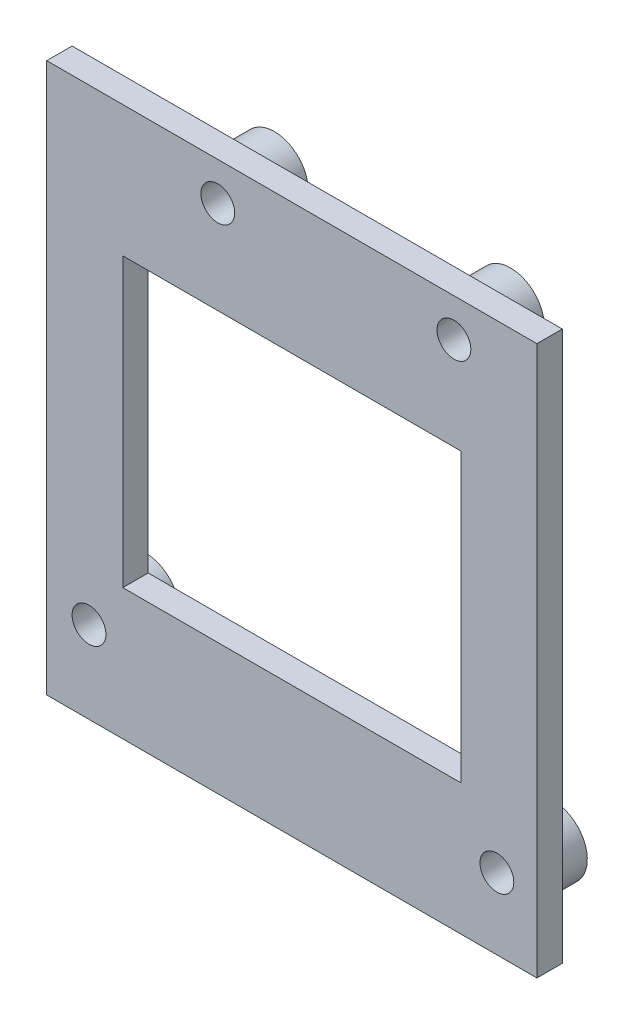
from build123d import *

# Parameters (mm, degrees)
ESQUISSE1_W               = 58
ESQUISSE1_H               = 65
T_LE_DE_BASE_PLI_E1_DEPTH = 3
ENL_V_MAT_EXTRU_1_REACH   = 45.661
ESQUISSE6_R               = 2
ENL_V_MAT_EXTRU_2_REACH   = 45.661
ESQUISSE7_R               = 2
ESQUISSE8_R               = 4
ESQUISSE8_R_2             = 2
BOSS_EXTRU_1_DEPTH        = 2.7
ESQUISSE11_R              = 4
BOSS_EXTRU_3_DEPTH        = 1
ENL_V_MAT_EXTRU_3_REACH   = 46.07
ESQUISSE9_W               = 40
ESQUISSE9_H               = 34
ESQUISSE12_R              = 4
ESQUISSE12_R_2            = 2
BOSS_EXTRU_4_DEPTH        = 3.7
ESQUISSE13_R              = 2
BOSS_EXTRU_5_DEPTH        = 1


# Sheet-metal steps are written as plain solids
with BuildPart() as part:
    # Esquisse1 → Tôle de base pliée1 (new body)
    with BuildSketch(Plane.XY):
        Rectangle(ESQUISSE1_W, ESQUISSE1_H)
    extrude(amount=-T_LE_DE_BASE_PLI_E1_DEPTH)

    # Esquisse6 → Enlèv. mat.-Extru.1 (cut, up to next)
    with BuildSketch(Plane.XY, mode=Mode.PRIVATE) as enl_v_mat_extru_1_sk1:
        with Locations((-8.76, 28)):
            Circle(ESQUISSE6_R)
    enl_v_mat_extru_1_tool1 = extrude(enl_v_mat_extru_1_sk1.sketch, amount=-ENL_V_MAT_EXTRU_1_REACH, mode=Mode.PRIVATE) & part.part
    # Esquisse6 → Enlèv. mat.-Extru.1 (cut, up to next)
    with BuildSketch(Plane.XY, mode=Mode.PRIVATE) as enl_v_mat_extru_1_sk2:
        with Locations((19.18, 28)):
            Circle(ESQUISSE6_R)
    enl_v_mat_extru_1_tool2 = extrude(enl_v_mat_extru_1_sk2.sketch, amount=-ENL_V_MAT_EXTRU_1_REACH, mode=Mode.PRIVATE) & part.part
    # Esquisse6 → Enlèv. mat.-Extru.1 (cut, up to next)
    with BuildSketch(Plane.XY, mode=Mode.PRIVATE) as enl_v_mat_extru_1_sk3:
        with Locations((-24, -22.8)):
            Circle(ESQUISSE6_R)
    enl_v_mat_extru_1_tool3 = extrude(enl_v_mat_extru_1_sk3.sketch, amount=-ENL_V_MAT_EXTRU_1_REACH, mode=Mode.PRIVATE) & part.part
    # Esquisse6 → Enlèv. mat.-Extru.1 (cut, up to next)
    with BuildSketch(Plane.XY, mode=Mode.PRIVATE) as enl_v_mat_extru_1_sk4:
        with Locations((24.26, -24.07)):
            Circle(ESQUISSE6_R)
    enl_v_mat_extru_1_tool4 = extrude(enl_v_mat_extru_1_sk4.sketch, amount=-ENL_V_MAT_EXTRU_1_REACH, mode=Mode.PRIVATE) & part.part
    add(enl_v_mat_extru_1_tool1.solids().sort_by_distance((-8.76, 28, 0))[0], mode=Mode.SUBTRACT)
    add(enl_v_mat_extru_1_tool2.solids().sort_by_distance((19.18, 28, 0))[0], mode=Mode.SUBTRACT)
    add(enl_v_mat_extru_1_tool3.solids().sort_by_distance((-24, -22.8, 0))[0], mode=Mode.SUBTRACT)
    add(enl_v_mat_extru_1_tool4.solids().sort_by_distance((24.26, -24.07, 0))[0], mode=Mode.SUBTRACT)

    # Esquisse7 → Enlèv. mat.-Extru.2 (cut, up to next)
    with BuildSketch(Plane.XY, mode=Mode.PRIVATE) as enl_v_mat_extru_2_sk1:
        with Locations((-17, -26.25)):
            Circle(ESQUISSE7_R)
    enl_v_mat_extru_2_tool1 = extrude(enl_v_mat_extru_2_sk1.sketch, amount=-ENL_V_MAT_EXTRU_2_REACH, mode=Mode.PRIVATE) & part.part
    # Esquisse7 → Enlèv. mat.-Extru.2 (cut, up to next)
    with BuildSketch(Plane.XY, mode=Mode.PRIVATE) as enl_v_mat_extru_2_sk2:
        with Locations((0, -26.25)):
            Circle(ESQUISSE7_R)
    enl_v_mat_extru_2_tool2 = extrude(enl_v_mat_extru_2_sk2.sketch, amount=-ENL_V_MAT_EXTRU_2_REACH, mode=Mode.PRIVATE) & part.part
    # Esquisse7 → Enlèv. mat.-Extru.2 (cut, up to next)
    with BuildSketch(Plane.XY, mode=Mode.PRIVATE) as enl_v_mat_extru_2_sk3:
        with Locations((17, -26.25)):
            Circle(ESQUISSE7_R)
    enl_v_mat_extru_2_tool3 = extrude(enl_v_mat_extru_2_sk3.sketch, amount=-ENL_V_MAT_EXTRU_2_REACH, mode=Mode.PRIVATE) & part.part
    # Esquisse7 → Enlèv. mat.-Extru.2 (cut, up to next)
    with BuildSketch(Plane.XY, mode=Mode.PRIVATE) as enl_v_mat_extru_2_sk4:
        with Locations((0, 21.25)):
            Circle(ESQUISSE7_R)
    enl_v_mat_extru_2_tool4 = extrude(enl_v_mat_extru_2_sk4.sketch, amount=-ENL_V_MAT_EXTRU_2_REACH, mode=Mode.PRIVATE) & part.part
    # Esquisse7 → Enlèv. mat.-Extru.2 (cut, up to next)
    with BuildSketch(Plane.XY, mode=Mode.PRIVATE) as enl_v_mat_extru_2_sk5:
        with Locations((17, 21.25)):
            Circle(ESQUISSE7_R)
    enl_v_mat_extru_2_tool5 = extrude(enl_v_mat_extru_2_sk5.sketch, amount=-ENL_V_MAT_EXTRU_2_REACH, mode=Mode.PRIVATE) & part.part
    # Esquisse7 → Enlèv. mat.-Extru.2 (cut, up to next)
    with BuildSketch(Plane.XY, mode=Mode.PRIVATE) as enl_v_mat_extru_2_sk6:
        with Locations((-17, 21.25)):
            Circle(ESQUISSE7_R)
    enl_v_mat_extru_2_tool6 = extrude(enl_v_mat_extru_2_sk6.sketch, amount=-ENL_V_MAT_EXTRU_2_REACH, mode=Mode.PRIVATE) & part.part
    add(enl_v_mat_extru_2_tool1.solids().sort_by_distance((-17, -26.25, 0))[0], mode=Mode.SUBTRACT)
    add(enl_v_mat_extru_2_tool2.solids().sort_by_distance((0, -26.25, 0))[0], mode=Mode.SUBTRACT)
    add(enl_v_mat_extru_2_tool3.solids().sort_by_distance((17, -26.25, 0))[0], mode=Mode.SUBTRACT)
    add(enl_v_mat_extru_2_tool4.solids().sort_by_distance((0, 21.25, 0))[0], mode=Mode.SUBTRACT)
    add(enl_v_mat_extru_2_tool5.solids().sort_by_distance((17, 21.25, 0))[0], mode=Mode.SUBTRACT)
    add(enl_v_mat_extru_2_tool6.solids().sort_by_distance((-17, 21.25, 0))[0], mode=Mode.SUBTRACT)

    # Esquisse8 → Boss.-Extru.1 (add)
    # profile 1 of 4: a face of its own
    with BuildSketch(Plane.XY.offset(-3)):
        with Locations((-8.76, 28)):
            Circle(ESQUISSE8_R)
        with Locations((-8.76, 28)):
            Circle(ESQUISSE8_R_2, mode=Mode.SUBTRACT)
    # profile 2 of 4: a face of its own
    with BuildSketch(Plane.XY.offset(-3)):
        with Locations((19.18, 28)):
            Circle(ESQUISSE8_R)
        with Locations((19.18, 28)):
            Circle(ESQUISSE8_R_2, mode=Mode.SUBTRACT)
    # profile 3 of 4: a face of its own
    with BuildSketch(Plane.XY.offset(-3)):
        with Locations((24.26, -24.07)):
            Circle(ESQUISSE8_R)
        with Locations((24.26, -24.07)):
            Circle(ESQUISSE8_R_2, mode=Mode.SUBTRACT)
    # profile 4 of 4: a face of its own
    with BuildSketch(Plane.XY.offset(-3)):
        with Locations((-24, -22.8)):
            Circle(ESQUISSE8_R)
        with Locations((-24, -22.8)):
            Circle(ESQUISSE8_R_2, mode=Mode.SUBTRACT)
    extrude(amount=-BOSS_EXTRU_1_DEPTH)

    # Esquisse11 → Boss.-Extru.3 (add)
    with BuildSketch(Plane(origin=(0, 0, -5.7), x_dir=(-1, 0, 0), z_dir=(0, 0, -1))):
        with Locations(Location((24, -22.8, 0), (0, 0, 180))):
            Circle(ESQUISSE11_R)
        with Locations(Location((8.76, 28, 0), (0, 0, 180))):
            Circle(ESQUISSE11_R)
        with Locations(Location((-24.26, -24.07, 0), (0, 0, 180))):
            Circle(ESQUISSE11_R)
        with Locations(Location((-19.18, 28, 0), (0, 0, 180))):
            Circle(ESQUISSE11_R)
    extrude(amount=BOSS_EXTRU_3_DEPTH)

    # Esquisse9 → Enlèv. mat.-Extru.3 (cut, up to next)
    with BuildSketch(Plane.XY, mode=Mode.PRIVATE) as enl_v_mat_extru_3_sk1:
        Rectangle(ESQUISSE9_W, ESQUISSE9_H)
    enl_v_mat_extru_3_tool1 = extrude(enl_v_mat_extru_3_sk1.sketch, amount=-ENL_V_MAT_EXTRU_3_REACH, mode=Mode.PRIVATE) & part.part
    add(enl_v_mat_extru_3_tool1.solids().sort_by_distance((0, 0, 0))[0], mode=Mode.SUBTRACT)

    # Esquisse12 → Boss.-Extru.4 (add)
    # profile 1 of 6: a face of its own
    with BuildSketch(Plane(origin=(0, 0, -3), x_dir=(-1, 0, 0), z_dir=(0, 0, -1))):
        with Locations((-17, 21.25)):
            Circle(ESQUISSE12_R)
        with Locations(Location((-17, 21.25, 0), (0, 0, 180))):
            Circle(ESQUISSE12_R_2, mode=Mode.SUBTRACT)
    # profile 2 of 6: a face of its own
    with BuildSketch(Plane(origin=(0, 0, -3), x_dir=(-1, 0, 0), z_dir=(0, 0, -1))):
        with Locations(Location((0, 21.25, 0), (0, 0, 180))):
            Circle(ESQUISSE12_R)
        with Locations(Location((0, 21.25, 0), (0, 0, 180))):
            Circle(ESQUISSE12_R_2, mode=Mode.SUBTRACT)
    # profile 3 of 6: a face of its own
    with BuildSketch(Plane(origin=(0, 0, -3), x_dir=(-1, 0, 0), z_dir=(0, 0, -1))):
        with Locations(Location((17, 21.25, 0), (0, 0, 180))):
            Circle(ESQUISSE12_R)
        with Locations(Location((17, 21.25, 0), (0, 0, 180))):
            Circle(ESQUISSE12_R_2, mode=Mode.SUBTRACT)
    # profile 4 of 6: a face of its own
    with BuildSketch(Plane(origin=(0, 0, -3), x_dir=(-1, 0, 0), z_dir=(0, 0, -1))):
        with Locations((17, -26.25)):
            Circle(ESQUISSE12_R)
        with Locations(Location((17, -26.25, 0), (0, 0, 180))):
            Circle(ESQUISSE12_R_2, mode=Mode.SUBTRACT)
    # profile 5 of 6: a face of its own
    with BuildSketch(Plane(origin=(0, 0, -3), x_dir=(-1, 0, 0), z_dir=(0, 0, -1))):
        with Locations(Location((0, -26.25, 0), (0, 0, 180))):
            Circle(ESQUISSE12_R)
        with Locations(Location((0, -26.25, 0), (0, 0, 180))):
            Circle(ESQUISSE12_R_2, mode=Mode.SUBTRACT)
    # profile 6 of 6: a face of its own
    with BuildSketch(Plane(origin=(0, 0, -3), x_dir=(-1, 0, 0), z_dir=(0, 0, -1))):
        with Locations((-17, -26.25)):
            Circle(ESQUISSE12_R)
        with Locations(Location((-17, -26.25, 0), (0, 0, 180))):
            Circle(ESQUISSE12_R_2, mode=Mode.SUBTRACT)
    extrude(amount=BOSS_EXTRU_4_DEPTH)

    # Esquisse13 → Boss.-Extru.5 (add)
    with BuildSketch(Plane.XY):
        with Locations((-17, 21.25)):
            Circle(ESQUISSE13_R)
        with Locations((-17, -26.25)):
            Circle(ESQUISSE13_R)
        with Locations((0, 21.25)):
            Circle(ESQUISSE13_R)
        with Locations((0, -26.25)):
            Circle(ESQUISSE13_R)
        with Locations((17, -26.25)):
            Circle(ESQUISSE13_R)
        with Locations((17, 21.25)):
            Circle(ESQUISSE13_R)
    extrude(amount=-BOSS_EXTRU_5_DEPTH)


solid = part.part
